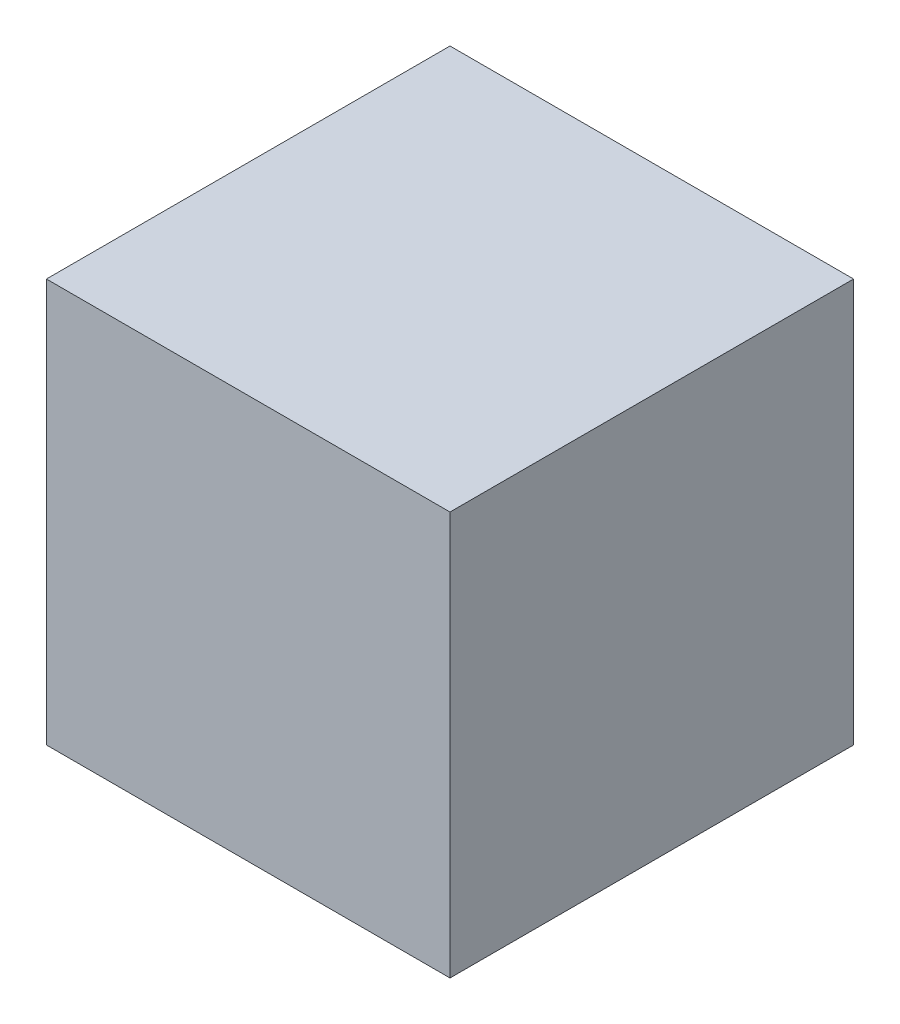
from build123d import *

# Parameters (mm, degrees)
SKETCH1_W           = 1000
SKETCH1_H           = 1000
BOSS_EXTRUDE1_DEPTH = 1000


with BuildPart() as part:
    # Sketch1 → Boss-Extrude1 (new body)
    with BuildSketch(Plane.XY):
        with Locations((-500, 500)):
            Rectangle(SKETCH1_W, SKETCH1_H)
    extrude(amount=BOSS_EXTRUDE1_DEPTH)


solid = part.part
